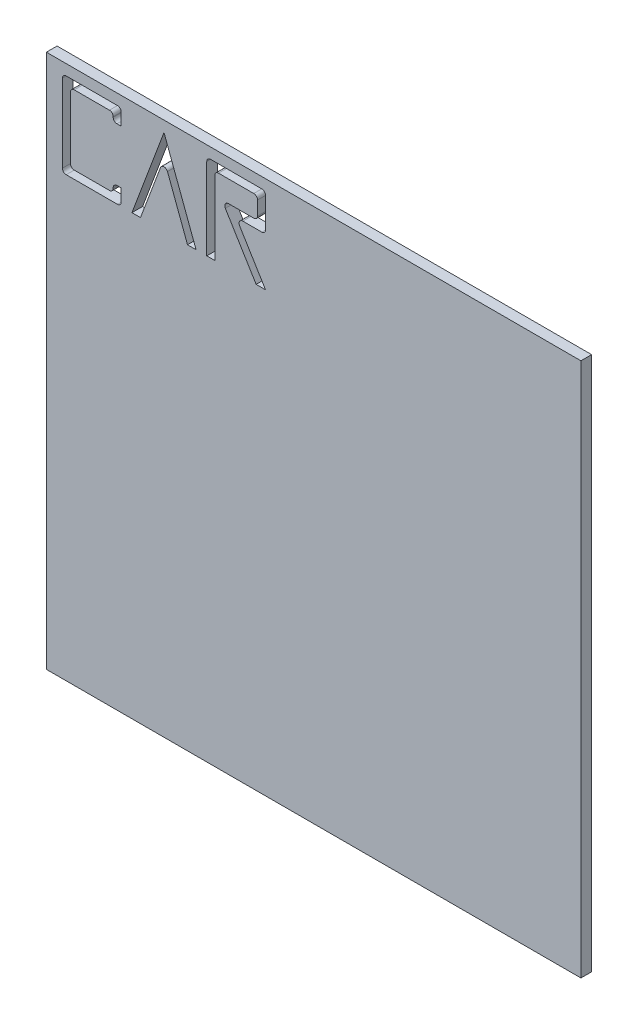
from build123d import *

# Parameters (mm, degrees)
ESQUISSE1_W             = 100
ESQUISSE1_H             = 100
BOSS_EXTRU_1_DEPTH      = 2
ENL_V_MAT_EXTRU_2_DEPTH = 10
CONG_1_R                = 0.7


with BuildPart() as part:
    # Esquisse1 → Boss.-Extru.1 (new body)
    with BuildSketch(Plane.XY):
        Rectangle(ESQUISSE1_W, ESQUISSE1_H)
    extrude(amount=BOSS_EXTRU_1_DEPTH)

    # Esquisse3 → Enlèv. mat.-Extru.2 (cut)
    with BuildSketch(Plane.XY.offset(2)):
        Polygon((-36, 32), (-36, 35), (-37.5, 35), (-37.5, 33.5), (-45.5, 33.5), (-45.5, 46.5), (-37.5, 46.5), (-37.5, 45), (-36, 45), (-36, 48), (-47, 48), (-47, 32), align=None)
        Polygon((-28, 48), (-34, 32), (-32.397999298, 32), (-28, 43.727998127), (-23.602000702, 32), (-22, 32), align=None)
        Polygon((-20, 48), (-20, 32), (-18.5, 32), (-18.5, 46.5), (-10.5, 46.5), (-10.5, 42.5), (-17.174585259, 42.5), (-10.757918592, 32), (-9, 32), (-14.5, 41), (-9, 41), (-9, 48), align=None)
    extrude(amount=-ENL_V_MAT_EXTRU_2_DEPTH, mode=Mode.SUBTRACT)

    # Congé1
    cong_1_edges = [part.edges().sort_by_distance(p)[0] for p in [
        (-36, 48, 1),
        (-45.5, 46.5, 1),
        (-45.5, 33.5, 1),
        (-37.5, 33.5, 1),
        (-37.5, 45, 1),
        (-37.5, 35, 1),
        (-47, 48, 1),
        (-47, 32, 1),
        (-37.5, 46.5, 1),
        (-36, 32, 1),
        (-17.174585259, 42.5, 1),
        (-9, 41, 1),
        (-9, 48, 1),
        (-10.5, 42.5, 1),
        (-20, 48, 1),
        (-10.5, 46.5, 1),
        (-18.5, 46.5, 1),
        (-14.5, 41, 1),
        (-28, 43.727998127, 1),
    ]]
    fillet(cong_1_edges, radius=CONG_1_R)


solid = part.part
